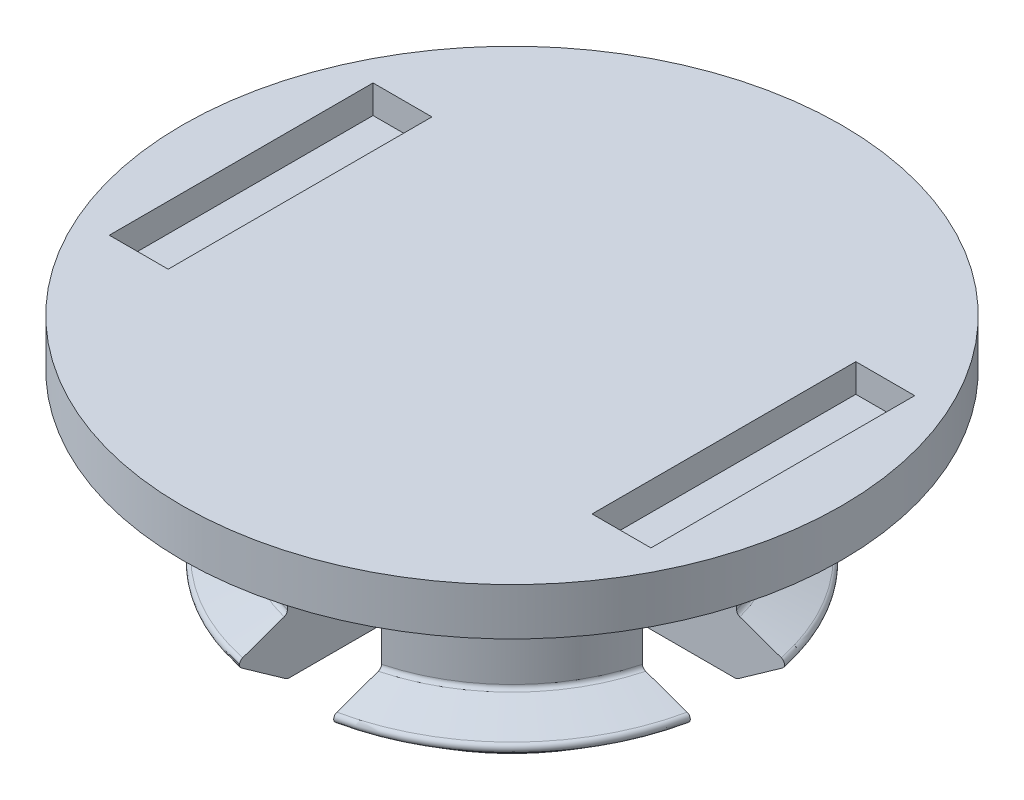
from build123d import *

# Parameters (mm, degrees)
SZKIC1_R                    = 7
DODANIE_WYCI_GNI_CIE1_DEPTH = 1
SZKIC2_R                    = 3.9
DODANIE_WYCI_GNI_CIE2_DEPTH = 4.3
ZAOKR_GLENIE1_R             = 0.1
WYTNIJ_WYCI_GNI_CIE1_DEPTH  = 4.3
SZKIC8_W                    = 1.25
SZKIC8_H                    = 5.6
WYTNIJ_WYCI_GNI_CIE2_DEPTH  = 0.6


with BuildPart() as part:
    # Szkic1 → Dodanie-wyciągnięcie1 (new body)
    with BuildSketch(Plane(origin=(0, 0, 0), x_dir=(1, 0, 0), z_dir=(0, 1, 0))):
        Circle(SZKIC1_R)
    extrude(amount=DODANIE_WYCI_GNI_CIE1_DEPTH)

    # Szkic2 → Dodanie-wyciągnięcie2 (add)
    with BuildSketch(Plane(origin=(0, 0, 0), x_dir=(-1, 0, 0), z_dir=(0, -1, 0))):
        Circle(SZKIC2_R)
    extrude(amount=DODANIE_WYCI_GNI_CIE2_DEPTH)

    # Szkic3 → Obrót1 (revolve)
    with BuildSketch(Plane(origin=(0, 0, 0), x_dir=(0, 0, -1), z_dir=(1, 0, 0))):
        Polygon((3.9, -4.3), (5, -3.500367258), (3.9, -3.1), align=None)
    revolve(axis=Axis((0, -4.3, 0), (0, 1, 0)))

    # Zaokrąglenie1
    zaokr_glenie1_edges = [part.edges().sort_by_distance(p)[0] for p in [
        (0, -3.500367258, 5),
        (2.757716447, -3.1, 2.757716447),
        (0, -4.3, 3.9),
    ]]
    fillet(zaokr_glenie1_edges, radius=ZAOKR_GLENIE1_R)

    # Szkic5 → Wytnij-wyciągnięcie1 (cut)
    with BuildSketch(Plane(origin=(0, -4.3, 0), x_dir=(-1, 0, 0), z_dir=(0, -1, 0))):
        with BuildLine():
            Line((-7.794060286, -1), (-1, -1))
            Line((-1, -1), (-1, -7.794060286))
            ThreePointArc((-1, -7.794060286), (0, -7.857949844), (1, -7.794060286))
            Line((1, -7.794060286), (1, -1))
            Line((1, -1), (7.794060286, -1))
            ThreePointArc((7.794060286, -1), (7.857949844, 0), (7.794060286, 1))
            Line((7.794060286, 1), (1, 1))
            Line((1, 1), (1, 7.794060286))
            ThreePointArc((1, 7.794060286), (0, 7.857949844), (-1, 7.794060286))
            Line((-1, 7.794060286), (-1, 1))
            Line((-1, 1), (-7.794060286, 1))
            ThreePointArc((-7.794060286, 1), (-7.857949844, 0), (-7.794060286, -1))
        make_face()
    extrude(amount=-WYTNIJ_WYCI_GNI_CIE1_DEPTH, mode=Mode.SUBTRACT)

    # Szkic8 → Wytnij-wyciągnięcie2 (cut)
    with BuildSketch(Plane(origin=(0, 1, 0), x_dir=(1, 0, 0), z_dir=(0, 1, 0))):
        with Locations((5.125, 0)):
            Rectangle(SZKIC8_W, SZKIC8_H)
        with Locations((-5.125, 0)):
            Rectangle(SZKIC8_W, SZKIC8_H)
    extrude(amount=-WYTNIJ_WYCI_GNI_CIE2_DEPTH, mode=Mode.SUBTRACT)


solid = part.part
